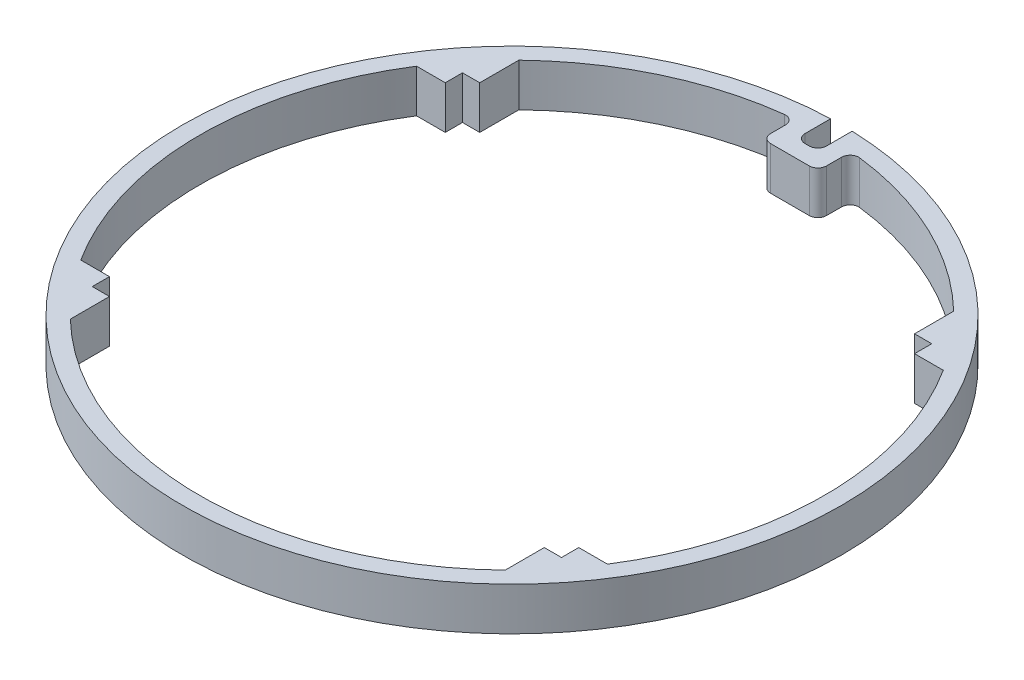
from build123d import *

# Parameters (mm, degrees)
BOSS_EXTRUDE1_DEPTH = 10


with BuildPart() as part:
    # Sketch1 → Boss-Extrude1 (new body)
    with BuildSketch(Plane(origin=(0, 0, 0), x_dir=(1, 0, 0), z_dir=(0, 1, 0))):
        with BuildLine():
            Line((-0.5, 68.548309499), (0.5, 68.548309499))
            ThreePointArc((0.5, 68.548309499), (1.914213562, 69.134095936), (2.5, 70.548309499))
            Line((2.5, 70.548309499), (2.5, 76.509166118))
            ThreePointArc((2.5, 76.509166118), (0, -76.55), (-2.5, 76.509166118))
            Line((-2.5, 76.509166118), (-2.5, 70.548309499))
            ThreePointArc((-2.5, 70.548309499), (-1.914213562, 69.134095936), (-0.5, 68.548309499))
        make_face()
        with BuildLine():
            Line((-4.498898253, 64.545545648), (4.504620523, 64.545545648))
            ThreePointArc((4.504620523, 64.545545648), (5.918834085, 65.131332086), (6.504620523, 66.545545648))
            Line((6.504620523, 66.545545648), (6.504620523, 70.035519058))
            ThreePointArc((6.504620523, 70.035519058), (7.178383305, 71.532547729), (8.745715364, 72.020934198))
            ThreePointArc((8.745715364, 72.020934198), (31.254364336, 65.472644745), (50.5, 52.08889037))
            Line((50.5, 52.08889037), (50.5, 43))
            Line((50.5, 43), (54.5, 43))
            Line((54.5, 43), (54.5, 39))
            Line((54.5, 39), (61.17599611, 39))
            ThreePointArc((61.17599611, 39), (72.55, 0), (61.17599611, -39))
            Line((61.17599611, -39), (54.5, -39))
            Line((54.5, -39), (54.5, -43))
            Line((54.5, -43), (50.5, -43))
            Line((50.5, -43), (50.5, -52.08889037))
            ThreePointArc((50.5, -52.08889037), (0, -72.55), (-50.5, -52.08889037))
            Line((-50.5, -52.08889037), (-50.5, -43))
            Line((-50.5, -43), (-54.5, -43))
            Line((-54.5, -43), (-54.5, -39))
            Line((-54.5, -39), (-61.17599611, -39))
            ThreePointArc((-61.17599611, -39), (-72.50088526, 0), (-61.17599611, 39))
            Line((-61.17599611, 39), (-54.5, 39))
            Line((-54.5, 39), (-54.5, 43))
            Line((-54.5, 43), (-50.5, 43))
            Line((-50.5, 43), (-50.5, 52.08889037))
            ThreePointArc((-50.5, 52.08889037), (-31.251689593, 65.473921507), (-8.739830875, 72.021648525))
            ThreePointArc((-8.739830875, 72.021648525), (-7.172599878, 71.533188183), (-6.498898253, 70.036213693))
            Line((-6.498898253, 70.036213693), (-6.498898253, 66.545545648))
            ThreePointArc((-6.498898253, 66.545545648), (-5.913111815, 65.131332086), (-4.498898253, 64.545545648))
        make_face(mode=Mode.SUBTRACT)
    extrude(amount=BOSS_EXTRUDE1_DEPTH)


solid = part.part
